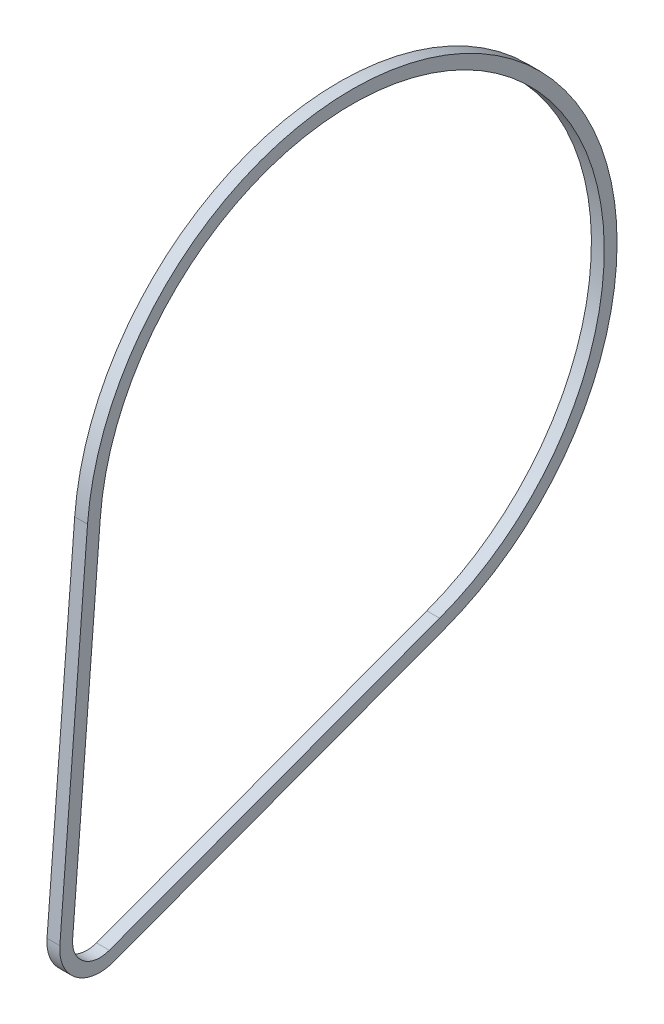
from build123d import *

# Parameters (mm, degrees)
BOSS_EXTRUDE1_DEPTH = 5.08


with BuildPart() as part:
    # Sketch1 → Boss-Extrude1 (new body)
    with BuildSketch(Plane(origin=(0, 0, 0), x_dir=(0, 0, -1), z_dir=(1, 0, 0))):
        with BuildLine():
            Line((113.852850078, 148.049756434), (102.893138, 9.002677201))
            ThreePointArc((102.893138, 9.002677201), (109.146477682, -4.908902036), (124.236288002, -7.130144614))
            Line((124.236288002, -7.130144614), (255.020142222, 41.344477687))
            ThreePointArc((255.020142222, 41.344477687), (281.842877023, 223.562297743), (113.852850078, 148.049756434))
        make_face()
        with BuildLine():
            Line((118.91714318, 147.650588076), (107.957431102, 8.603508843))
            ThreePointArc((107.957431102, 8.603508843), (112.209702075, -0.856365013), (122.470773065, -2.366809962))
            Line((122.470773065, -2.366809962), (253.254627285, 46.107812339))
            ThreePointArc((253.254627285, 46.107812339), (278.779652631, 219.509760719), (118.91714318, 147.650588076))
        make_face(mode=Mode.SUBTRACT)
    extrude(amount=BOSS_EXTRUDE1_DEPTH)


solid = part.part
